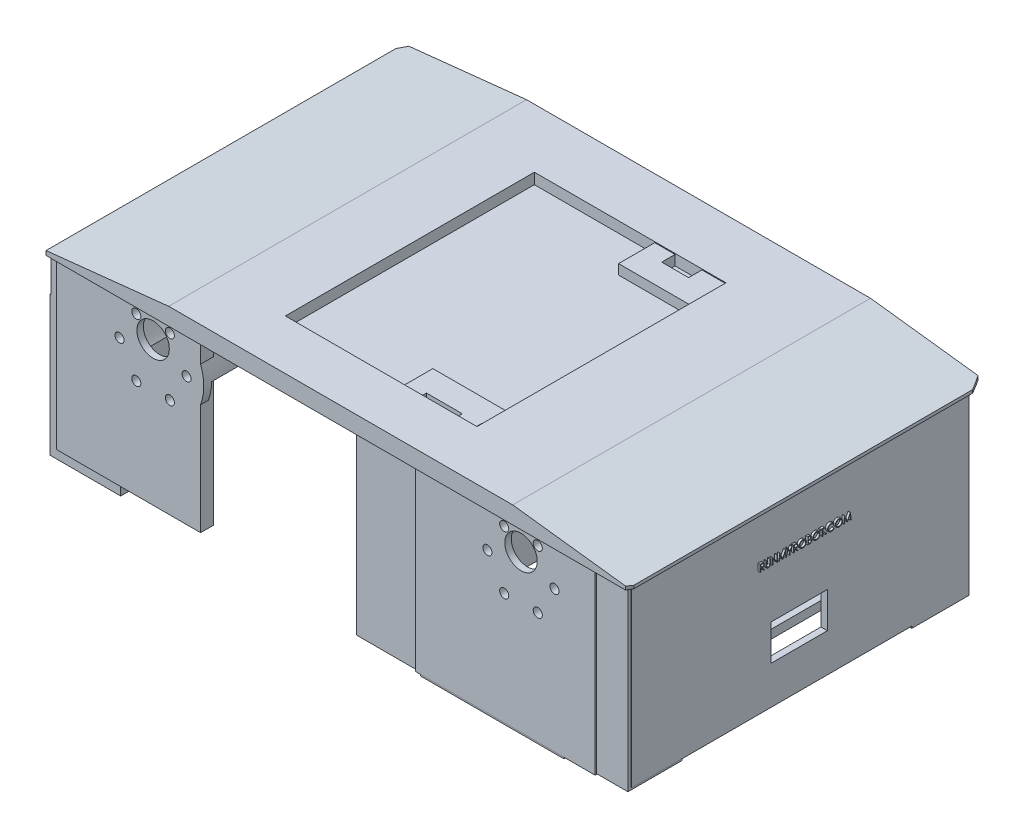
from build123d import *

# Parameters (mm, degrees)
MOTORHOLDERS_DEPTH            = 80
MOTORHOLDERS_DEPTH_BACK       = 80
MOTORHOLDERSSKETCH_R          = 23.41
MOTORHOLDERS_2_DEPTH          = 80
MOTORHOLDERS_2_DEPTH_BACK     = 80
SKETCH4_W                     = 262.774983374
SKETCH4_H                     = 153.112553215
CUT_EXTRUDE1_DEPTH            = 26
POWERBANKHOLDERS_DEPTH        = 30
POWERBANKHOLDERS_DEPTH_BACK   = 59
SKETCH6_W                     = 74.414236541
SKETCH6_H                     = 13.420779118
SKETCH6_W_2                   = 20.810206851
SKETCH6_H_2                   = 2.021058642
POWERBANKHOLDERS_2_DEPTH      = 30
POWERBANKHOLDERS_2_DEPTH_BACK = 59
SKETCH6_W_3                   = 32.64776113
SKETCH6_H_3                   = 26.17260787
SKETCH6_W_4                   = 10.842850571
SKETCH6_H_4                   = 10.347679347
POWERBANKHOLDERS_3_DEPTH      = 30
POWERBANKHOLDERS_3_DEPTH_BACK = 59
SKETCH6_W_5                   = 55.674763771
SKETCH6_H_5                   = 37.111507406
SKETCH6_W_6                   = 12.844328805
SKETCH6_H_6                   = 18.336479725
SKETCH6_W_7                   = 12.407504742
SKETCH6_H_7                   = 16.443461188
POWERBANKHOLDERS_4_DEPTH      = 30
POWERBANKHOLDERS_4_DEPTH_BACK = 59
SKETCH6_W_8                   = 56.474336521
SKETCH6_H_8                   = 35.272094794
SKETCH6_W_9                   = 11.134493861
SKETCH6_H_9                   = 18.035399163
SKETCH6_W_10                  = 16.537391536
SKETCH6_H_10                  = 14.436538778
POWERBANKHOLDERS_5_DEPTH      = 30
POWERBANKHOLDERS_5_DEPTH_BACK = 59
SKETCH6_W_11                  = 28.150495439
SKETCH6_H_11                  = 24.933985152
SKETCH6_W_12                  = 10.177859407
SKETCH6_H_12                  = 9.83070569
POWERBANKHOLDERS_6_DEPTH      = 30
POWERBANKHOLDERS_6_DEPTH_BACK = 59
SKETCH6_W_13                  = 30.670744753
SKETCH6_H_13                  = 26.330219561
SKETCH6_W_14                  = 9.898416255
SKETCH6_H_14                  = 10.635603546
POWERBANKCUT_DEPTH            = 64
BOTTOMPLATE_DEPTH             = 5
BOTTOMPLATE_DEPTH_BACK        = 3
SKETCH21_R                    = 156.395305675
SKETCH21_W                    = 88.537320887
SKETCH21_H                    = 115.069025425
SKETCH23_W                    = 66.548697278
SKETCH23_H                    = 81.163054316
SKETCH23_W_2                  = 82.936115801
SKETCH23_H_2                  = 87.063331284
MOTORMOUNTINGSUPPORT1_DEPTH   = 6
SKETCH24_W                    = 62.643465408
SKETCH24_H                    = 86.363062387
SKETCH24_W_2                  = 53.914675369
SKETCH24_H_2                  = 86.674739968
MOTORMOUNTINGSUPPOR2_DEPTH    = 6
SKETCH17_R                    = 2.1
SKETCH17_R_2                  = 7.5
MOTORHOLES1_DEPTH             = 31.5
SKETCH19_R                    = 2.1
SKETCH19_R_2                  = 7.5
CUT_EXTRUDE4_DEPTH            = 30
BOLTHOLESSKETCH3_R            = 2.1
BOLTHOLESSKETCH3_R_2          = 7.5
MOTORHOLES3_DEPTH             = 31.5
BOLTHOLESSKETCH4_R            = 2.1
BOLTHOLESSKETCH4_R_2          = 7.5
MOTORHOLES4_DEPTH             = 15
SKETCH29_W                    = 154.635205036
SKETCH29_H                    = 84.131588093
SKETCH29_W_2                  = 26
SKETCH29_H_2                  = 16.5
BOSS_EXTRUDE8_DEPTH           = 3
SKETCH27_W                    = 226.46009322
SKETCH27_H                    = 129.985211715
BOSS_EXTRUDE6_DEPTH           = 3
BOSS_EXTRUDE7_DEPTH           = 1.5
BOSS_EXTRUDE7_DEPTH_BACK      = 2.5
SKETCH28_W                    = 66.387115975
SKETCH28_H                    = 157.698901517
MOTORHOLDERCUT_DEPTH          = 77
MOTORHOLDERCUT_DEPTH_BACK     = 77
MOTORHOLDEREXTRUDESKETCH_R    = 20.415
BOSS_EXTRUDE9_DEPTH           = 1
CUT_EXTRUDE5_DEPTH            = 20
CUT_EXTRUDE5_DEPTH_BACK       = 20
SKETCH32_W                    = 420.045569038
SKETCH32_H                    = 425.046527557
SKETCH32_W_2                  = 269.205670794
SKETCH32_H_2                  = 165.352220901
CUT_EXTRUDE7_DEPTH            = 200


with BuildPart() as part:
    # MotorHoldersSketch → MotorHolders (new, two sides: drawn at the far end of the back side and taken through both)
    with BuildSketch(Plane.XY.offset(-MOTORHOLDERS_DEPTH_BACK)):
        Circle(MOTORHOLDERSSKETCH_R)
    extrude(amount=MOTORHOLDERS_DEPTH + MOTORHOLDERS_DEPTH_BACK)


with BuildPart() as body_2:
    # MotorHoldersSketch → MotorHolders 2 (new, two sides: drawn at the far end of the back side and taken through both)
    with BuildSketch(Plane.XY.offset(-MOTORHOLDERS_2_DEPTH_BACK)):
        with Locations((170, 0)):
            Circle(MOTORHOLDERSSKETCH_R)
    extrude(amount=MOTORHOLDERS_2_DEPTH + MOTORHOLDERS_2_DEPTH_BACK)


with BuildPart() as cut_extrude1_tool:
    # Sketch4 → Cut-Extrude1 (new body)
    with BuildSketch(Plane(origin=(0, 0, 0), x_dir=(1, 0, 0), z_dir=(0, 1, 0))):
        with Locations((89.893628689, 0.176832173)):
            Rectangle(SKETCH4_W, SKETCH4_H)
    extrude(amount=-CUT_EXTRUDE1_DEPTH)


with BuildPart() as part_1:
    add(part.part)

    # Cut-Extrude1: cut by cut_extrude1_tool
    add(cut_extrude1_tool.part, mode=Mode.SUBTRACT)


with BuildPart() as body_2_1:
    add(body_2.part)

    # Cut-Extrude1: cut by cut_extrude1_tool
    add(cut_extrude1_tool.part, mode=Mode.SUBTRACT)


with BuildPart() as body_3:
    # Sketch6 → PowerBankHolders (new, two sides: drawn at the far end of the back side and taken through both)
    with BuildSketch(Plane(origin=(170, -34.829272125, 0), x_dir=(-1, 0, 0), z_dir=(0, -1, 0)).offset(-POWERBANKHOLDERS_DEPTH_BACK)):
        with Locations((182.378728269, 72.238602394)):
            Rectangle(SKETCH6_W, SKETCH6_H)
        with Locations((203.359863582, 72.025840015)):
            Rectangle(SKETCH6_W_2, SKETCH6_H_2, mode=Mode.SUBTRACT)
    extrude(amount=POWERBANKHOLDERS_DEPTH + POWERBANKHOLDERS_DEPTH_BACK)


with BuildPart() as body_4:
    # Sketch6 → PowerBankHolders 2 (new, two sides: drawn at the far end of the back side and taken through both)
    with BuildSketch(Plane(origin=(170, -34.829272125, 0), x_dir=(-1, 0, 0), z_dir=(0, -1, 0)).offset(-POWERBANKHOLDERS_2_DEPTH_BACK)):
        with Locations((202.990846936, -65.195848087)):
            Rectangle(SKETCH6_W_3, SKETCH6_H_3)
        with Locations((206.519672379, -65.314281269)):
            Rectangle(SKETCH6_W_4, SKETCH6_H_4, mode=Mode.SUBTRACT)
    extrude(amount=POWERBANKHOLDERS_2_DEPTH + POWERBANKHOLDERS_2_DEPTH_BACK)


with BuildPart() as body_5:
    # Sketch6 → PowerBankHolders 3 (new, two sides: drawn at the far end of the back side and taken through both)
    with BuildSketch(Plane(origin=(170, -34.829272125, 0), x_dir=(-1, 0, 0), z_dir=(0, -1, 0)).offset(-POWERBANKHOLDERS_3_DEPTH_BACK)):
        with Locations((47.827743092, 59.306920349)):
            Rectangle(SKETCH6_W_5, SKETCH6_H_5)
        with Locations((34.93306737, 60.00949088)):
            Rectangle(SKETCH6_W_6, SKETCH6_H_6, mode=Mode.SUBTRACT)
        with Locations((60.073413265, 59.541495334)):
            Rectangle(SKETCH6_W_7, SKETCH6_H_7, mode=Mode.SUBTRACT)
    extrude(amount=POWERBANKHOLDERS_3_DEPTH + POWERBANKHOLDERS_3_DEPTH_BACK)


with BuildPart() as body_6:
    # Sketch6 → PowerBankHolders 4 (new, two sides: drawn at the far end of the back side and taken through both)
    with BuildSketch(Plane(origin=(170, -34.829272125, 0), x_dir=(-1, 0, 0), z_dir=(0, -1, 0)).offset(-POWERBANKHOLDERS_4_DEPTH_BACK)):
        with Locations((48.322417758, -61.807610384)):
            Rectangle(SKETCH6_W_8, SKETCH6_H_8)
        with Locations((37.73953158, -63.792391966)):
            Rectangle(SKETCH6_W_9, SKETCH6_H_9, mode=Mode.SUBTRACT)
        with Locations((59.979410768, -62.645522509)):
            Rectangle(SKETCH6_W_10, SKETCH6_H_10, mode=Mode.SUBTRACT)
    extrude(amount=POWERBANKHOLDERS_4_DEPTH + POWERBANKHOLDERS_4_DEPTH_BACK)


with BuildPart() as body_7:
    # Sketch6 → PowerBankHolders 5 (new, two sides: drawn at the far end of the back side and taken through both)
    with BuildSketch(Plane(origin=(170, -34.829272125, 0), x_dir=(-1, 0, 0), z_dir=(0, -1, 0)).offset(-POWERBANKHOLDERS_5_DEPTH_BACK)):
        with Locations((-34.775388772, -66.976665205)):
            Rectangle(SKETCH6_W_11, SKETCH6_H_11)
        with Locations((-36.725173705, -67.894738702)):
            Rectangle(SKETCH6_W_12, SKETCH6_H_12, mode=Mode.SUBTRACT)
    extrude(amount=POWERBANKHOLDERS_5_DEPTH + POWERBANKHOLDERS_5_DEPTH_BACK)


with BuildPart() as body_8:
    # Sketch6 → PowerBankHolders 6 (new, two sides: drawn at the far end of the back side and taken through both)
    with BuildSketch(Plane(origin=(170, -34.829272125, 0), x_dir=(-1, 0, 0), z_dir=(0, -1, 0)).offset(-POWERBANKHOLDERS_6_DEPTH_BACK)):
        with Locations((-33.722690809, 64.697564271)):
            Rectangle(SKETCH6_W_13, SKETCH6_H_13)
        with Locations((-36.585452129, 63.859928969)):
            Rectangle(SKETCH6_W_14, SKETCH6_H_14, mode=Mode.SUBTRACT)
    extrude(amount=POWERBANKHOLDERS_6_DEPTH + POWERBANKHOLDERS_6_DEPTH_BACK)


with BuildPart() as powerbankcut_tool:
    # Sketch11 → PowerBankCut (new body)
    with BuildSketch(Plane(origin=(0, -20.425, 0), x_dir=(1, 0, 0), z_dir=(0, 1, 0))):
        Polygon((-18.932660375, -64.758061011), (-18.932660375, 72.241938989), (188.932660375, 63.758061011), (188.932660375, -71.241938989), align=None)
    extrude(amount=-POWERBANKCUT_DEPTH)


with BuildPart() as body_3_1:
    add(body_3.part)

    # PowerBankCut: cut by powerbankcut_tool
    add(powerbankcut_tool.part, mode=Mode.SUBTRACT)



with BuildPart() as body_4_1:
    add(body_4.part)

    # PowerBankCut: cut by powerbankcut_tool
    add(powerbankcut_tool.part, mode=Mode.SUBTRACT)


with BuildPart() as body_5_1:
    add(body_5.part)

    # PowerBankCut: cut by powerbankcut_tool
    add(powerbankcut_tool.part, mode=Mode.SUBTRACT)


with BuildPart() as body_6_1:
    add(body_6.part)

    # PowerBankCut: cut by powerbankcut_tool
    add(powerbankcut_tool.part, mode=Mode.SUBTRACT)


with BuildPart() as body_8_1:
    add(body_8.part)

    # PowerBankCut: cut by powerbankcut_tool
    add(powerbankcut_tool.part, mode=Mode.SUBTRACT)


with BuildPart() as body_3_2:
    add(body_3_1.part)

    add(body_4_1.part)  # BottomPlate merges body 4

    add(body_2_1.part)  # BottomPlate merges body 2

    add(part_1.part)  # BottomPlate merges part

    add(body_5_1.part)  # BottomPlate merges body 5

    add(body_6_1.part)  # BottomPlate merges body 6
    # Sketch21 → BottomPlate (add, two sides: drawn at the far end of the back side and taken through both)
    with BuildSketch(Plane(origin=(0, 19.575, 0), x_dir=(1, 0, 0), z_dir=(0, 1, 0)).offset(-BOTTOMPLATE_DEPTH_BACK)):
        with Locations((85, 0)):
            Circle(SKETCH21_R)
        with Locations((82.978570093, -0.057259585)):
            Rectangle(SKETCH21_W, SKETCH21_H, mode=Mode.SUBTRACT)
    extrude(amount=BOTTOMPLATE_DEPTH + BOTTOMPLATE_DEPTH_BACK)


    add(body_7.part)  # MotorMountingSupport1 merges body 7
    # Sketch23 → MotorMountingSupport1 (add)
    with BuildSketch(Plane.XY.offset(80)):
        with Locations((-11.315777772, -18.741332274)):
            Rectangle(SKETCH23_W, SKETCH23_H)
        with Locations((162.789906406, -21.691470758)):
            Rectangle(SKETCH23_W_2, SKETCH23_H_2)
    extrude(amount=-MOTORMOUNTINGSUPPORT1_DEPTH)


    add(body_8_1.part)  # MotorMountingSuppor2 merges body 8
    # Sketch24 → MotorMountingSuppor2 (add)
    with BuildSketch(Plane(origin=(0, 0, -80), x_dir=(-1, 0, 0), z_dir=(0, 0, -1))):
        with Locations((-170.868787608, -23.94412431)):
            Rectangle(SKETCH24_W, SKETCH24_H)
        with Locations((2.593149567, -20.814772641)):
            Rectangle(SKETCH24_W_2, SKETCH24_H_2)
    extrude(amount=-MOTORMOUNTINGSUPPOR2_DEPTH)

    # Sketch17 → MotorHoles1 (cut)
    with BuildSketch(Plane.XY.offset(80)):
        with Locations((185.5, 0)):
            Circle(SKETCH17_R)
        with Locations((177.75, -13.42)):
            Circle(SKETCH17_R)
        with Locations((162.25, -13.42)):
            Circle(SKETCH17_R)
        with Locations((154.5, 0)):
            Circle(SKETCH17_R)
        with Locations((162.25, 13.42)):
            Circle(SKETCH17_R)
        with Locations((177.75, 13.42)):
            Circle(SKETCH17_R)
        with Locations((170, 7)):
            Circle(SKETCH17_R_2)
    extrude(amount=-MOTORHOLES1_DEPTH, mode=Mode.SUBTRACT)

    # Sketch19 → Cut-Extrude4 (cut)
    with BuildSketch(Plane(origin=(0, 0, -80), x_dir=(-1, 0, 0), z_dir=(0, 0, -1))):
        with Locations((-185.5, 0)):
            Circle(SKETCH19_R)
        with Locations((-177.75, -13.42)):
            Circle(SKETCH19_R)
        with Locations((-162.25, -13.42)):
            Circle(SKETCH19_R)
        with Locations((-154.5, 0)):
            Circle(SKETCH19_R)
        with Locations((-162.25, 13.42)):
            Circle(SKETCH19_R)
        with Locations((-177.75, 13.42)):
            Circle(SKETCH19_R)
        with Locations((-170, 7)):
            Circle(SKETCH19_R_2)
    extrude(amount=-CUT_EXTRUDE4_DEPTH, mode=Mode.SUBTRACT)

    # BoltHolesSketch3 → MotorHoles3 (cut)
    with BuildSketch(Plane.XY.offset(80)):
        with Locations((7.75, -13.42)):
            Circle(BOLTHOLESSKETCH3_R)
        with Locations((15.5, 0)):
            Circle(BOLTHOLESSKETCH3_R)
        with Locations((7.75, 13.42)):
            Circle(BOLTHOLESSKETCH3_R)
        with Locations((-7.75, 13.42)):
            Circle(BOLTHOLESSKETCH3_R)
        with Locations((-15.5, 0)):
            Circle(BOLTHOLESSKETCH3_R)
        with Locations((-7.75, -13.42)):
            Circle(BOLTHOLESSKETCH3_R)
        with Locations((0, 7)):
            Circle(BOLTHOLESSKETCH3_R_2)
    extrude(amount=-MOTORHOLES3_DEPTH, mode=Mode.SUBTRACT)

    # BoltHolesSketch4 → MotorHoles4 (cut)
    with BuildSketch(Plane(origin=(0, 0, -80), x_dir=(-1, 0, 0), z_dir=(0, 0, -1))):
        with Locations((-15.5, 0)):
            Circle(BOLTHOLESSKETCH4_R)
        with Locations((-7.75, 13.42)):
            Circle(BOLTHOLESSKETCH4_R)
        with Locations((7.75, 13.42)):
            Circle(BOLTHOLESSKETCH4_R)
        with Locations((15.5, 0)):
            Circle(BOLTHOLESSKETCH4_R)
        with Locations((7.75, -13.42)):
            Circle(BOLTHOLESSKETCH4_R)
        with Locations((-7.75, -13.42)):
            Circle(BOLTHOLESSKETCH4_R)
        with Locations((0, 7)):
            Circle(BOLTHOLESSKETCH4_R_2)
    extrude(amount=-MOTORHOLES4_DEPTH, mode=Mode.SUBTRACT)

    # Sketch29 → Boss-Extrude8 (add)
    with BuildSketch(Plane(origin=(219.058063185, 0, 0), x_dir=(0, 0, -1), z_dir=(1, 0, 0))):
        with Locations((-0.622085312, -21.859578752)):
            Rectangle(SKETCH29_W, SKETCH29_H)
        with Locations((-0.45071267, -38.005879342)):
            Rectangle(SKETCH29_W_2, SKETCH29_H_2, mode=Mode.SUBTRACT)
    extrude(amount=-BOSS_EXTRUDE8_DEPTH)

    # Sketch27 → Boss-Extrude6 (add)
    with BuildSketch(Plane(origin=(0, 16.575, 0), x_dir=(-1, 0, 0), z_dir=(0, -1, 0))):
        with Locations((-81.596376522, -0.440920076)):
            Rectangle(SKETCH27_W, SKETCH27_H)
    extrude(amount=-BOSS_EXTRUDE6_DEPTH)

    # Sketch28 → Boss-Extrude7 (add, two sides: drawn at the far end of the back side and taken through both)
    with BuildSketch(Plane(origin=(0, -64.829272125, 0), x_dir=(-1, 0, 0), z_dir=(0, -1, 0)).offset(-BOSS_EXTRUDE7_DEPTH_BACK)):
        with Locations((-156.196154729, -0.699595313)):
            Rectangle(SKETCH28_W, SKETCH28_H)
    extrude(amount=BOSS_EXTRUDE7_DEPTH + BOSS_EXTRUDE7_DEPTH_BACK)

    # MotorHolderExtrudeSketch → MotorHolderCut (cut, two sides: drawn at the far end of the back side and taken through both)
    with BuildSketch(Plane.XY.offset(-MOTORHOLDERCUT_DEPTH_BACK)):
        with Locations((170, 0)):
            Circle(MOTORHOLDEREXTRUDESKETCH_R)
        Circle(MOTORHOLDEREXTRUDESKETCH_R)
    extrude(amount=MOTORHOLDERCUT_DEPTH + MOTORHOLDERCUT_DEPTH_BACK, mode=Mode.SUBTRACT)

    # Sketch31 → Boss-Extrude9 (add)
    # profile 1 of 14: a face of its own
    with BuildSketch(Plane(origin=(219.058063185, 0, 0), x_dir=(0, 0, -1), z_dir=(1, 0, 0))):
        with BuildLine():
            Line((-19.523067462, -3.211949724), (-18.887685851, -3.211949724))
            add(Edge.make_bspline(
                [(-18.887685851, -3.211949724), (-18.84528497, -3.212090863), (-18.763870582, -3.212361865), (-18.647236258, -3.21387295), (-18.541257392, -3.218203972), (-18.445989395, -3.221931045), (-18.361434015, -3.228727306), (-18.287331972, -3.235223036), (-18.224024561, -3.243726285), (-18.185701539, -3.251623347), (-18.168349914, -3.255198923)],
                knots=[0, 0, 0, 0, 1.410062039, 2.707475311, 3.878576406, 4.937260626, 5.877586885, 6.699081471, 7.410979367, 8, 8, 8, 8], degree=3))
            add(Edge.make_bspline(
                [(-18.168349914, -3.255198923), (-18.145121047, -3.260938203), (-18.09915885, -3.272294329), (-18.032982719, -3.296296966), (-17.969923296, -3.32407334), (-17.910242527, -3.356697572), (-17.854239345, -3.394411837), (-17.801336306, -3.436565062), (-17.75129335, -3.482926599), (-17.7061343, -3.534665348), (-17.663553874, -3.58894561), (-17.627641334, -3.647641161), (-17.596683742, -3.709019832), (-17.572036202, -3.773705847), (-17.552189754, -3.841071883), (-17.538195951, -3.911728148), (-17.529803803, -3.985352747), (-17.528949405, -4.035570279), (-17.52851618, -4.061033258)],
                knots=[0, 0, 0, 0, 1.027469482, 2.033020251, 3.019912614, 3.986113645, 4.951240523, 5.91722682, 6.890402269, 7.87763091, 8.8651537, 9.85103654, 10.82876324, 11.815024772, 12.821070561, 13.842952187, 14.906261191, 16, 16, 16, 16], degree=3))
            add(Edge.make_bspline(
                [(-17.52851618, -4.061033258), (-17.529848771, -4.10333796), (-17.532449001, -4.185885391), (-17.556692488, -4.305683476), (-17.596404045, -4.417433783), (-17.651125886, -4.520995604), (-17.720812125, -4.614350261), (-17.8045639, -4.696347317), (-17.902427933, -4.764963524), (-17.993531669, -4.812545711), (-18.074008122, -4.843019278), (-18.14025977, -4.864460832), (-18.2125291, -4.881027043), (-18.290123682, -4.89586802), (-18.373366426, -4.907072771), (-18.462057819, -4.915279325), (-18.556261114, -4.920408355), (-18.620975841, -4.921172174), (-18.654267382, -4.921565109)],
                knots=[0, 0, 0, 0, 1.260483769, 2.459530307, 3.627416485, 4.787058657, 5.939039949, 7.08810263, 8.267026773, 9.491475466, 10.141966685, 10.831826277, 11.566392101, 12.351337768, 13.187381173, 14.07005841, 15.007169909, 16, 16, 16, 16], degree=3))
            Line((-18.654267382, -4.921565109), (-17.487811051, -6.386949724))
            Line((-17.487811051, -6.386949724), (-17.840164818, -6.386949724))
            Line((-17.840164818, -6.386949724), (-19.006621148, -4.921565109))
            Line((-19.006621148, -4.921565109), (-19.238131564, -4.921565109))
            Line((-19.238131564, -4.921565109), (-19.238131564, -6.386949724))
            Line((-19.238131564, -6.386949724), (-19.523067462, -6.386949724))
            Line((-19.523067462, -6.386949724), (-19.523067462, -3.211949724))
        make_face()
        with BuildLine():
            Line((-19.238131564, -3.53759075), (-19.238131564, -4.595924083))
            Line((-19.238131564, -4.595924083), (-18.656811452, -4.600376207))
            add(Edge.make_bspline(
                [(-18.656811452, -4.600376207), (-18.629669703, -4.600388214), (-18.577061261, -4.600411488), (-18.500951373, -4.596788563), (-18.430085271, -4.592667124), (-18.364734018, -4.586363075), (-18.304868417, -4.578238638), (-18.250518392, -4.568075931), (-18.201595224, -4.556235846), (-18.144537264, -4.537910085), (-18.080822696, -4.508876054), (-18.011579158, -4.466634495), (-17.952612751, -4.413503937), (-17.902794405, -4.352749444), (-17.862762706, -4.285950847), (-17.834539628, -4.213908855), (-17.816630413, -4.138442191), (-17.814518089, -4.086573479), (-17.813452077, -4.06039724)],
                knots=[0, 0, 0, 0, 1.146690395, 2.22261258, 3.21895312, 4.145990853, 4.996080663, 5.770904154, 6.481378293, 7.121626537, 8.300444488, 9.431385265, 10.535395872, 11.636531494, 12.74115979, 13.810798291, 14.895190096, 16, 16, 16, 16], degree=3))
            add(Edge.make_bspline(
                [(-17.813452077, -4.06039724), (-17.814542573, -4.034864277), (-17.816703537, -3.98426726), (-17.834346348, -3.910193685), (-17.864181716, -3.840282951), (-17.904388317, -3.774819454), (-17.953373265, -3.715396394), (-18.010811567, -3.664553619), (-18.075132708, -3.622598748), (-18.135250152, -3.595788703), (-18.188984045, -3.579351407), (-18.235638094, -3.56778428), (-18.288353506, -3.558491083), (-18.347386243, -3.551045199), (-18.412484294, -3.544645357), (-18.483976813, -3.540334815), (-18.561389464, -3.537782238), (-18.61504418, -3.537656065), (-18.642819064, -3.53759075)],
                knots=[0, 0, 0, 0, 1.101028733, 2.181837193, 3.264309656, 4.369019818, 5.486613113, 6.575447106, 7.666700264, 8.788928104, 9.402425223, 10.0903467, 10.862060571, 11.710948788, 12.657782767, 13.684531032, 14.801375019, 16, 16, 16, 16], degree=3))
            Line((-18.642819064, -3.53759075), (-19.238131564, -3.53759075))
        make_face(mode=Mode.SUBTRACT)
    # profile 2 of 14: a face of its own
    with BuildSketch(Plane(origin=(219.058063185, 0, 0), x_dir=(0, 0, -1), z_dir=(1, 0, 0))):
        with BuildLine():
            Line((-16.836529, -3.211949724), (-16.551593103, -3.211949724))
            Line((-16.551593103, -3.211949724), (-16.551593103, -5.11427845))
            add(Edge.make_bspline(
                [(-16.551593103, -5.11427845), (-16.551635506, -5.141203118), (-16.551715974, -5.192297314), (-16.551178479, -5.265021415), (-16.549673195, -5.329675717), (-16.548724179, -5.38650944), (-16.546612955, -5.435261789), (-16.544891155, -5.476196892), (-16.542677222, -5.509120919), (-16.540016465, -5.528335045), (-16.53887275, -5.536594155)],
                knots=[0, 0, 0, 0, 1.528628734, 2.90083645, 4.128790002, 5.200304208, 6.127813768, 6.898992206, 7.526736466, 8, 8, 8, 8], degree=3))
            add(Edge.make_bspline(
                [(-16.53887275, -5.536594155), (-16.534176055, -5.566390862), (-16.525047308, -5.624305338), (-16.501782379, -5.706772136), (-16.469290789, -5.781095673), (-16.430788886, -5.849595202), (-16.380050017, -5.910364121), (-16.319268239, -5.966345406), (-16.245628406, -6.015305543), (-16.163749142, -6.06007378), (-16.075497534, -6.096055676), (-15.985317314, -6.123263942), (-15.89456404, -6.139845516), (-15.83380709, -6.141765519), (-15.803636372, -6.142718955)],
                knots=[0, 0, 0, 0, 1.035780045, 2.013197591, 2.933192213, 3.817615948, 4.702609284, 5.640816605, 6.646850145, 7.73207398, 8.84249596, 9.914020372, 10.964143139, 12, 12, 12, 12], degree=3))
            add(Edge.make_bspline(
                [(-15.803636372, -6.142718955), (-15.77773405, -6.141744819), (-15.726079012, -6.139802174), (-15.649328893, -6.127772162), (-15.574580223, -6.106090935), (-15.501463892, -6.078114868), (-15.432928356, -6.041150982), (-15.368935376, -5.998451006), (-15.311818093, -5.948366854), (-15.259695481, -5.892940113), (-15.214306646, -5.830401866), (-15.174962825, -5.762113841), (-15.142735732, -5.687048362), (-15.126821248, -5.634293993), (-15.118645386, -5.607192112)],
                knots=[0, 0, 0, 0, 0.994687771, 1.983630487, 2.973142513, 3.978332533, 4.983357753, 5.956394766, 6.925816176, 7.893390482, 8.871859704, 9.88551698, 10.913711441, 12, 12, 12, 12], degree=3))
            add(Edge.make_bspline(
                [(-15.118645386, -5.607192112), (-15.115923844, -5.595990191), (-15.109859151, -5.571027797), (-15.104192189, -5.52882634), (-15.098289841, -5.479033846), (-15.094194481, -5.421292558), (-15.090201945, -5.355795962), (-15.087813372, -5.282202857), (-15.08670935, -5.200780471), (-15.086380347, -5.143959617), (-15.086208487, -5.11427845)],
                knots=[0, 0, 0, 0, 0.558680831, 1.244966039, 2.062412453, 2.990489873, 4.051219941, 5.244515665, 6.560634259, 8, 8, 8, 8], degree=3))
            Line((-15.086208487, -5.11427845), (-15.086208487, -3.211949724))
            Line((-15.086208487, -3.211949724), (-14.80127259, -3.211949724))
            Line((-14.80127259, -3.211949724), (-14.80127259, -5.129542873))
            add(Edge.make_bspline(
                [(-14.80127259, -5.129542873), (-14.801503113, -5.164103546), (-14.801952994, -5.231550799), (-14.805854231, -5.330385246), (-14.81207451, -5.424141165), (-14.82086299, -5.512831158), (-14.832507985, -5.59613786), (-14.84545765, -5.674791471), (-14.861949083, -5.7482274), (-14.881210811, -5.817018236), (-14.903230387, -5.882500809), (-14.931752, -5.944647909), (-14.963887082, -6.005348829), (-15.002000375, -6.06368547), (-15.044827843, -6.119916129), (-15.093316154, -6.17369979), (-15.145861642, -6.225895925), (-15.203337814, -6.275165635), (-15.264797219, -6.320349221), (-15.330057038, -6.360080056), (-15.398615965, -6.393665766), (-15.470295786, -6.421311783), (-15.545127092, -6.442098598), (-15.623111768, -6.457588204), (-15.704427322, -6.466389574), (-15.759730975, -6.46769761), (-15.787735931, -6.468359981)],
                knots=[0, 0, 0, 0, 1.316592851, 2.569410997, 3.76748051, 4.895814652, 5.963796859, 6.97159953, 7.931736103, 8.829262218, 9.692595152, 10.560224239, 11.431080259, 12.30701507, 13.211635791, 14.121146779, 15.063487852, 16.031507147, 17.00238618, 17.966455255, 18.938106653, 19.907068911, 20.888905087, 21.893141452, 22.933117798, 24, 24, 24, 24], degree=3))
            add(Edge.make_bspline(
                [(-15.787735931, -6.468359981), (-15.818278617, -6.467648086), (-15.878203258, -6.466251353), (-15.96650279, -6.458247858), (-16.051152097, -6.4431726), (-16.133045214, -6.423977508), (-16.211067208, -6.397503689), (-16.286263404, -6.366571819), (-16.357345922, -6.328583161), (-16.425467931, -6.286316298), (-16.48880896, -6.238759662), (-16.546954461, -6.186925361), (-16.60000043, -6.131643733), (-16.647052747, -6.072316258), (-16.688890978, -6.009404353), (-16.724931957, -5.942730042), (-16.755877543, -5.872319141), (-16.771849215, -5.823375881), (-16.779923431, -5.798633418)],
                knots=[0, 0, 0, 0, 1.13879206, 2.234305948, 3.301075583, 4.341971843, 5.366689343, 6.369221514, 7.369726634, 8.367512178, 9.355451585, 10.318319045, 11.268648973, 12.207971039, 13.137398894, 14.081662264, 15.030215811, 16, 16, 16, 16], degree=3))
            add(Edge.make_bspline(
                [(-16.779923431, -5.798633418), (-16.784619853, -5.781731011), (-16.794806497, -5.745069314), (-16.80571516, -5.684393714), (-16.814885541, -5.614530182), (-16.823508441, -5.535473935), (-16.828596567, -5.447163699), (-16.833057386, -5.349637754), (-16.836560426, -5.242778174), (-16.836539768, -5.168343007), (-16.836529, -5.129542873)],
                knots=[0, 0, 0, 0, 0.625038921, 1.35572334, 2.194682327, 3.136881307, 4.189498639, 5.346923369, 6.617055217, 8, 8, 8, 8], degree=3))
            Line((-16.836529, -5.129542873), (-16.836529, -3.211949724))
        make_face()
    # profile 3 of 14: a face of its own
    with BuildSketch(Plane(origin=(219.058063185, 0, 0), x_dir=(0, 0, -1), z_dir=(1, 0, 0))):
        Polygon((-13.987170026, -6.386949724), (-13.987170026, -3.211949724), (-13.927384369, -3.211949724), (-11.829798231, -5.710862985), (-11.829798231, -3.211949724), (-11.544862334, -3.211949724), (-11.544862334, -6.386949724), (-11.609736132, -6.386949724), (-13.702234128, -3.893760622), (-13.702234128, -6.386949724), align=None)
    # profile 4 of 14: a face of its own
    with BuildSketch(Plane(origin=(219.058063185, 0, 0), x_dir=(0, 0, -1), z_dir=(1, 0, 0))):
        Polygon((-10.893580282, -6.386949724), (-10.474444665, -3.211949724), (-10.433739537, -3.211949724), (-9.122907205, -5.817077929), (-7.815254962, -3.211949724), (-7.773913816, -3.211949724), (-7.352234128, -6.386949724), (-7.638442061, -6.386949724), (-7.942458487, -4.102374404), (-9.088562253, -6.386949724), (-9.152800034, -6.386949724), (-10.303355923, -4.097286263), (-10.606736332, -6.386949724), align=None)
    # profile 5 of 14: a face of its own
    with BuildSketch(Plane(origin=(219.058063185, 0, 0), x_dir=(0, 0, -1), z_dir=(1, 0, 0))):
        Polygon((-6.945182846, -3.211949724), (-6.618905803, -3.211949724), (-5.784450675, -4.576207537), (-4.951267582, -3.211949724), (-4.624990539, -3.211949724), (-5.642618744, -4.877679892), (-5.642618744, -6.386949724), (-5.927554641, -6.386949724), (-5.927554641, -4.877679892), align=None)
    # profile 6 of 14: a face of its own
    with BuildSketch(Plane(origin=(219.058063185, 0, 0), x_dir=(0, 0, -1), z_dir=(1, 0, 0))):
        with BuildLine():
            Line((-4.055118744, -3.211949724), (-3.419737133, -3.211949724))
            add(Edge.make_bspline(
                [(-3.419737133, -3.211949724), (-3.377336252, -3.212090863), (-3.295921864, -3.212361865), (-3.17928754, -3.21387295), (-3.073308674, -3.218203972), (-2.978040677, -3.221931045), (-2.893485297, -3.228727306), (-2.819383255, -3.235223036), (-2.756075843, -3.243726285), (-2.717752821, -3.251623347), (-2.700401196, -3.255198923)],
                knots=[0, 0, 0, 0, 1.410062039, 2.707475311, 3.878576406, 4.937260626, 5.877586885, 6.699081471, 7.410979367, 8, 8, 8, 8], degree=3))
            add(Edge.make_bspline(
                [(-2.700401196, -3.255198923), (-2.67717233, -3.260938203), (-2.631210132, -3.272294329), (-2.565034001, -3.296296966), (-2.501974578, -3.32407334), (-2.442293809, -3.356697572), (-2.386290627, -3.394411837), (-2.333387588, -3.436565062), (-2.283344632, -3.482926599), (-2.238185582, -3.534665348), (-2.195605156, -3.58894561), (-2.159692616, -3.647641161), (-2.128735024, -3.709019832), (-2.104087484, -3.773705847), (-2.084241036, -3.841071883), (-2.070247233, -3.911728148), (-2.061855085, -3.985352747), (-2.061000687, -4.035570279), (-2.060567462, -4.061033258)],
                knots=[0, 0, 0, 0, 1.027469482, 2.033020251, 3.019912614, 3.986113645, 4.951240523, 5.91722682, 6.890402269, 7.87763091, 8.8651537, 9.85103654, 10.82876324, 11.815024772, 12.821070561, 13.842952187, 14.906261191, 16, 16, 16, 16], degree=3))
            add(Edge.make_bspline(
                [(-2.060567462, -4.061033258), (-2.061900053, -4.10333796), (-2.064500283, -4.185885391), (-2.08874377, -4.305683476), (-2.128455327, -4.417433783), (-2.183177168, -4.520995604), (-2.252863407, -4.614350261), (-2.336615182, -4.696347317), (-2.434479215, -4.764963524), (-2.525582952, -4.812545711), (-2.606059404, -4.843019278), (-2.672311052, -4.864460832), (-2.744580382, -4.881027043), (-2.822174964, -4.89586802), (-2.905417708, -4.907072771), (-2.994109101, -4.915279325), (-3.088312396, -4.920408355), (-3.153027123, -4.921172174), (-3.186318664, -4.921565109)],
                knots=[0, 0, 0, 0, 1.260483769, 2.459530307, 3.627416485, 4.787058657, 5.939039949, 7.08810263, 8.267026773, 9.491475466, 10.141966685, 10.831826277, 11.566392101, 12.351337768, 13.187381173, 14.07005841, 15.007169909, 16, 16, 16, 16], degree=3))
            Line((-3.186318664, -4.921565109), (-2.019862334, -6.386949724))
            Line((-2.019862334, -6.386949724), (-2.3722161, -6.386949724))
            Line((-2.3722161, -6.386949724), (-3.53867243, -4.921565109))
            Line((-3.53867243, -4.921565109), (-3.770182846, -4.921565109))
            Line((-3.770182846, -4.921565109), (-3.770182846, -6.386949724))
            Line((-3.770182846, -6.386949724), (-4.055118744, -6.386949724))
            Line((-4.055118744, -6.386949724), (-4.055118744, -3.211949724))
        make_face()
        with BuildLine():
            Line((-3.770182846, -3.53759075), (-3.770182846, -4.595924083))
            Line((-3.770182846, -4.595924083), (-3.188862734, -4.600376207))
            add(Edge.make_bspline(
                [(-3.188862734, -4.600376207), (-3.161720985, -4.600388214), (-3.109112543, -4.600411488), (-3.033002655, -4.596788563), (-2.962136553, -4.592667124), (-2.8967853, -4.586363075), (-2.836919699, -4.578238638), (-2.782569674, -4.568075931), (-2.733646506, -4.556235846), (-2.676588546, -4.537910085), (-2.612873978, -4.508876054), (-2.54363044, -4.466634495), (-2.484664033, -4.413503937), (-2.434845687, -4.352749444), (-2.394813988, -4.285950847), (-2.36659091, -4.213908855), (-2.348681695, -4.138442191), (-2.346569371, -4.086573479), (-2.345503359, -4.06039724)],
                knots=[0, 0, 0, 0, 1.146690395, 2.22261258, 3.21895312, 4.145990853, 4.996080663, 5.770904154, 6.481378293, 7.121626537, 8.300444488, 9.431385265, 10.535395872, 11.636531494, 12.74115979, 13.810798291, 14.895190096, 16, 16, 16, 16], degree=3))
            add(Edge.make_bspline(
                [(-2.345503359, -4.06039724), (-2.346593855, -4.034864277), (-2.348754819, -3.98426726), (-2.36639763, -3.910193685), (-2.396232998, -3.840282951), (-2.436439599, -3.774819454), (-2.485424547, -3.715396394), (-2.542862849, -3.664553619), (-2.60718399, -3.622598748), (-2.667301434, -3.595788703), (-2.721035327, -3.579351407), (-2.767689376, -3.56778428), (-2.820404788, -3.558491083), (-2.879437525, -3.551045199), (-2.944535576, -3.544645357), (-3.016028095, -3.540334815), (-3.093440746, -3.537782238), (-3.147095462, -3.537656065), (-3.174870346, -3.53759075)],
                knots=[0, 0, 0, 0, 1.101028733, 2.181837193, 3.264309656, 4.369019818, 5.486613113, 6.575447106, 7.666700264, 8.788928104, 9.402425223, 10.0903467, 10.862060571, 11.710948788, 12.657782767, 13.684531032, 14.801375019, 16, 16, 16, 16], degree=3))
            Line((-3.174870346, -3.53759075), (-3.770182846, -3.53759075))
        make_face(mode=Mode.SUBTRACT)
    # profile 7 of 14: a face of its own
    with BuildSketch(Plane(origin=(219.058063185, 0, 0), x_dir=(0, 0, -1), z_dir=(1, 0, 0))):
        with BuildLine():
            add(Edge.make_bspline(
                [(0.117156897, -3.130539468), (0.175947108, -3.132028524), (0.291415931, -3.134953153), (0.461119588, -3.157340626), (0.623130853, -3.196071444), (0.778769479, -3.247654292), (0.926173822, -3.316465056), (1.066453389, -3.399636584), (1.19927441, -3.498040228), (1.322846664, -3.610915313), (1.435928326, -3.733727446), (1.535556094, -3.86478955), (1.619051603, -4.003309178), (1.68761871, -4.148870074), (1.74141102, -4.301143045), (1.778530439, -4.460939891), (1.802241475, -4.627225245), (1.805013501, -4.740642472), (1.806419718, -4.798177689)],
                knots=[0, 0, 0, 0, 1.065120563, 2.091984664, 3.0946048, 4.079830382, 5.057816894, 6.036188127, 7.030412546, 8.04752943, 9.064399622, 10.05169764, 11.02544977, 11.989514704, 12.962713494, 13.945757189, 14.957906945, 16, 16, 16, 16], degree=3))
            add(Edge.make_bspline(
                [(1.806419718, -4.798177689), (1.805013708, -4.855289087), (1.802242299, -4.967862268), (1.778503479, -5.133092392), (1.741273429, -5.291924667), (1.688118245, -5.444093938), (1.619877989, -5.589760728), (1.535826512, -5.72854175), (1.436819843, -5.860482502), (1.324146485, -5.984137563), (1.201318397, -6.097528126), (1.069573798, -6.196333106), (0.931875572, -6.281354276), (0.786451765, -6.349193752), (0.635231017, -6.403415422), (0.47685991, -6.44038388), (0.312080536, -6.464229983), (0.19971184, -6.466968208), (0.142597602, -6.468359981)],
                knots=[0, 0, 0, 0, 1.043624062, 2.057103931, 3.04512605, 4.022047818, 4.998200453, 5.980619268, 6.982898556, 8.009068085, 9.034988726, 10.034168286, 11.015286542, 11.987931943, 12.962482838, 13.94673481, 14.956375938, 16, 16, 16, 16], degree=3))
            add(Edge.make_bspline(
                [(0.142597602, -6.468359981), (0.085062684, -6.466954465), (-0.028353954, -6.464183821), (-0.194848265, -6.440433546), (-0.354757361, -6.403293935), (-0.507623951, -6.350217518), (-0.65353328, -6.281621887), (-0.792770712, -6.197979343), (-0.924777367, -6.098731437), (-1.048458809, -5.986094615), (-1.161624153, -5.863474708), (-1.260284444, -5.732089348), (-1.343945796, -5.594516183), (-1.412311105, -5.450373429), (-1.466435293, -5.300357906), (-1.503360378, -5.14346893), (-1.527250849, -4.98060095), (-1.530003889, -4.869709178), (-1.531400795, -4.813442112)],
                knots=[0, 0, 0, 0, 1.053102029, 2.075944431, 3.073151272, 4.055350789, 5.033113405, 6.020478099, 7.024410459, 8.052272461, 9.079885166, 10.07527673, 11.055994387, 12.023226415, 12.992069828, 13.970394897, 14.97016774, 16, 16, 16, 16], degree=3))
            add(Edge.make_bspline(
                [(-1.531400795, -4.813442112), (-1.530915804, -4.775675334), (-1.529951941, -4.700618222), (-1.518348049, -4.589160663), (-1.501509934, -4.479495566), (-1.477378199, -4.371934778), (-1.445817187, -4.266741599), (-1.408577133, -4.16319055), (-1.363093131, -4.062331029), (-1.311675686, -3.963685238), (-1.254288189, -3.868790923), (-1.190900902, -3.779093015), (-1.123740246, -3.693838826), (-1.050113453, -3.615237615), (-0.972447106, -3.541002798), (-0.889481292, -3.47227519), (-0.801722256, -3.408435056), (-0.708792383, -3.350903747), (-0.612981519, -3.298870818), (-0.514214728, -3.254219567), (-0.41383341, -3.215896354), (-0.311367407, -3.184835034), (-0.207088821, -3.160313116), (-0.10077006, -3.143615016), (0.007504177, -3.131981528), (0.080448731, -3.131022223), (0.117156897, -3.130539468)],
                knots=[0, 0, 0, 0, 1.037015668, 2.060948919, 3.074880161, 4.083647147, 5.086022904, 6.090072063, 7.104153813, 8.122640571, 9.144368836, 10.147691507, 11.138137339, 12.123020368, 13.103399296, 14.087645067, 15.080126199, 16.082011238, 17.087798457, 18.072939717, 19.057185487, 20.037253025, 21.01195951, 21.997135196, 22.992090687, 24, 24, 24, 24], degree=3))
        make_face()
        with BuildLine():
            add(Edge.make_bspline(
                [(0.131149285, -3.456180493), (0.101018867, -3.456547787), (0.041046081, -3.457278862), (-0.048112034, -3.466908833), (-0.136097574, -3.480633803), (-0.22292871, -3.500211326), (-0.308242129, -3.526885002), (-0.392833057, -3.55758354), (-0.475930113, -3.594976958), (-0.557258969, -3.637225054), (-0.636103359, -3.68398729), (-0.710500595, -3.735668821), (-0.780643279, -3.791057652), (-0.846359671, -3.850283048), (-0.907456806, -3.913646615), (-0.965137214, -3.980187754), (-1.017088906, -4.051808398), (-1.064700822, -4.12656641), (-1.107307363, -4.204364415), (-1.145194506, -4.284383362), (-1.176186142, -4.367275978), (-1.201461298, -4.452142964), (-1.222416126, -4.538849909), (-1.235691186, -4.628054572), (-1.245426969, -4.719308709), (-1.246116258, -4.780977963), (-1.246464898, -4.812170077)],
                knots=[0, 0, 0, 0, 1.008559885, 2.007477868, 2.99961109, 3.989939068, 4.984837346, 5.991145699, 7.001802488, 8.033829008, 9.059044045, 10.069351652, 11.065060232, 12.050310815, 13.029377138, 14.011219647, 14.996725999, 15.989392538, 16.977580475, 17.965360261, 18.951710183, 19.937753436, 20.929683414, 21.935841486, 22.955955122, 24, 24, 24, 24], degree=3))
            add(Edge.make_bspline(
                [(-1.246464898, -4.812170077), (-1.245308416, -4.858037234), (-1.243033258, -4.948272122), (-1.223114605, -5.080504653), (-1.192433243, -5.207584741), (-1.147205489, -5.328817045), (-1.090644574, -5.445243644), (-1.020770181, -5.55583171), (-0.937985153, -5.660611132), (-0.843947525, -5.758850412), (-0.741147642, -5.848517677), (-0.631988665, -5.927224484), (-0.517640035, -5.993818067), (-0.397803559, -6.048069812), (-0.273119005, -6.091059074), (-0.142782941, -6.120521832), (-0.007663596, -6.139912424), (0.084439213, -6.141774567), (0.131149285, -6.142718955)],
                knots=[0, 0, 0, 0, 1.032063989, 2.030389145, 3.003944642, 3.970395727, 4.937377036, 5.913328081, 6.909231446, 7.93887556, 8.970685674, 9.976071282, 10.964166581, 11.944589148, 12.933237628, 13.927779006, 14.949070134, 16, 16, 16, 16], degree=3))
            add(Edge.make_bspline(
                [(0.131149285, -6.142718955), (0.162545047, -6.142287605), (0.224812273, -6.141432107), (0.317427497, -6.13281545), (0.408374203, -6.118997969), (0.497524829, -6.099103731), (0.584778193, -6.074205194), (0.670498479, -6.044625326), (0.753772642, -6.007721663), (0.835651209, -5.96694745), (0.914024943, -5.920465307), (0.988842033, -5.870537843), (1.058216672, -5.815230594), (1.123883901, -5.75688515), (1.185231876, -5.694325088), (1.24184574, -5.627631744), (1.29353486, -5.556384147), (1.341128697, -5.481739529), (1.383585942, -5.403728643), (1.420578411, -5.323419578), (1.45196203, -5.241010086), (1.477297174, -5.156381303), (1.497150414, -5.069693962), (1.510830055, -4.980831991), (1.520398996, -4.889973159), (1.521120245, -4.828519804), (1.52148382, -4.797541671)],
                knots=[0, 0, 0, 0, 1.047197238, 2.076906641, 3.100256066, 4.114471768, 5.12198147, 6.126382909, 7.136867548, 8.15857795, 9.17633901, 10.174870724, 11.156907918, 12.133735059, 13.104061851, 14.077631395, 15.04955518, 16.038496417, 17.029181396, 18.010275684, 18.986308667, 19.968651475, 20.955262928, 21.950658345, 22.966943676, 24, 24, 24, 24], degree=3))
            add(Edge.make_bspline(
                [(1.52148382, -4.797541671), (1.521119954, -4.766775464), (1.520398157, -4.705745024), (1.510834626, -4.615519853), (1.497135961, -4.527297297), (1.477394076, -4.441423704), (1.45194858, -4.357877185), (1.42057293, -4.276736207), (1.383574837, -4.197698487), (1.34111309, -4.120959375), (1.293383022, -4.047322291), (1.24122753, -3.976925817), (1.183746107, -3.911091973), (1.12258107, -3.8481955), (1.056204624, -3.789577843), (0.984917443, -3.735219557), (0.909584964, -3.683808801), (0.8298224, -3.637430613), (0.747504671, -3.594600559), (0.663037009, -3.55790572), (0.577376326, -3.526725298), (0.490740452, -3.500130622), (0.402400179, -3.48071048), (0.31295242, -3.466896464), (0.222520928, -3.457282214), (0.161703151, -3.456548899), (0.131149285, -3.456180493)],
                knots=[0, 0, 0, 0, 1.02996197, 2.043119294, 3.035359645, 4.018872909, 4.991431989, 5.957985074, 6.929999688, 7.912076566, 8.892894881, 9.867085534, 10.843653904, 11.817741046, 12.803660682, 13.806313499, 14.818574707, 15.856120519, 16.894564902, 17.924820532, 18.937903209, 19.946497019, 20.957711757, 21.963978472, 22.977135795, 24, 24, 24, 24], degree=3))
        make_face(mode=Mode.SUBTRACT)
    # profile 8 of 14: a face of its own
    with BuildSketch(Plane(origin=(219.058063185, 0, 0), x_dir=(0, 0, -1), z_dir=(1, 0, 0))):
        with BuildLine():
            Line((2.457701769, -3.211949724), (3.077182939, -3.211949724))
            add(Edge.make_bspline(
                [(3.077182939, -3.211949724), (3.107507344, -3.212109155), (3.166283588, -3.212418171), (3.251754082, -3.217210726), (3.33180836, -3.223745484), (3.40646964, -3.234114211), (3.47570342, -3.246625323), (3.539718348, -3.261776256), (3.598310861, -3.279943255), (3.668263129, -3.308832382), (3.748019729, -3.351761256), (3.834378271, -3.415196455), (3.908223545, -3.492786617), (3.971892561, -3.580310169), (4.022512148, -3.676590476), (4.059132868, -3.779332741), (4.082317512, -3.887211749), (4.084701877, -3.961273775), (4.085906897, -3.99870353)],
                knots=[0, 0, 0, 0, 1.001505555, 1.941167018, 2.826882275, 3.653841531, 4.429895133, 5.150066043, 5.825578002, 6.45369114, 7.647487171, 8.808567382, 9.977351308, 11.170798116, 12.373658725, 13.556498008, 14.765093433, 16, 16, 16, 16], degree=3))
            add(Edge.make_bspline(
                [(4.085906897, -3.99870353), (4.084915192, -4.03376692), (4.082966397, -4.102669788), (4.06433118, -4.203448015), (4.035156859, -4.299379478), (3.994602812, -4.390114071), (3.941896001, -4.473601705), (3.879431669, -4.550515868), (3.804069141, -4.617600041), (3.747605631, -4.65510396), (3.718924726, -4.674154251)],
                knots=[0, 0, 0, 0, 1.044552857, 2.05264487, 3.044412934, 4.028983338, 5.005914585, 5.980388656, 6.974128949, 8, 8, 8, 8], degree=3))
            add(Edge.make_bspline(
                [(3.718924726, -4.674154251), (3.754993114, -4.688001786), (3.824000874, -4.71449555), (3.918966043, -4.761336293), (4.000785652, -4.81228335), (4.070088778, -4.8679201), (4.129359365, -4.927890235), (4.181114533, -4.993073089), (4.225275494, -5.064318962), (4.263115074, -5.140885026), (4.292641446, -5.221989466), (4.314753874, -5.306871527), (4.327424345, -5.395226838), (4.32922742, -5.455357146), (4.330137666, -5.485712745)],
                knots=[0, 0, 0, 0, 1.27268992, 2.434971085, 3.483601985, 4.442670788, 5.356604649, 6.2567628, 7.179492994, 8.113709626, 9.066344395, 10.018646069, 10.999752585, 12, 12, 12, 12], degree=3))
            add(Edge.make_bspline(
                [(4.330137666, -5.485712745), (4.329251528, -5.516706979), (4.327508024, -5.577689003), (4.314644764, -5.667274018), (4.292865074, -5.752885576), (4.26286482, -5.835077421), (4.223710435, -5.913690543), (4.176060067, -5.988814004), (4.119244292, -6.059693003), (4.055687261, -6.127115147), (3.983785171, -6.187737497), (3.906210165, -6.241726745), (3.821985289, -6.286127816), (3.732493838, -6.323425921), (3.636731922, -6.351916737), (3.535129557, -6.371849001), (3.427774369, -6.385279284), (3.354105523, -6.386383463), (3.316325567, -6.386949724)],
                knots=[0, 0, 0, 0, 0.978564426, 1.925352924, 2.850884081, 3.763762016, 4.682927383, 5.618979971, 6.567305752, 7.547517671, 8.540179244, 9.531824382, 10.526200242, 11.540722885, 12.589160233, 13.674978461, 14.80764778, 16, 16, 16, 16], degree=3))
            Line((3.316325567, -6.386949724), (2.457701769, -6.386949724))
            Line((2.457701769, -6.386949724), (2.457701769, -3.211949724))
        make_face()
        with BuildLine():
            Line((2.742637666, -3.53759075), (2.742637666, -4.555218955))
            Line((2.742637666, -4.555218955), (2.934078973, -4.555218955))
            add(Edge.make_bspline(
                [(2.934078973, -4.555218955), (2.962063237, -4.554856168), (3.016134539, -4.554155189), (3.094439016, -4.552147212), (3.167123854, -4.546524702), (3.234063588, -4.540903807), (3.295152805, -4.531764717), (3.350256165, -4.520886148), (3.400238464, -4.509380941), (3.457877909, -4.489814335), (3.523258369, -4.46089673), (3.592956971, -4.416018707), (3.654401811, -4.362565901), (3.706287832, -4.300888386), (3.748752523, -4.23297406), (3.778247107, -4.159906533), (3.798247144, -4.083506841), (3.800053747, -4.031057426), (3.800971, -4.004427689)],
                knots=[0, 0, 0, 0, 1.156816544, 2.235205308, 3.236616184, 4.169592532, 5.011045266, 5.787822928, 6.49130361, 7.128639758, 8.301311294, 9.436451833, 10.541879658, 11.654887649, 12.756523258, 13.837046038, 14.901820046, 16, 16, 16, 16], degree=3))
            add(Edge.make_bspline(
                [(3.800971, -4.004427689), (3.800493679, -3.986805739), (3.799557363, -3.95223836), (3.79188901, -3.90184716), (3.778855567, -3.854454613), (3.762114887, -3.809411242), (3.738720862, -3.768125492), (3.711176863, -3.729169879), (3.677897701, -3.693871028), (3.640017853, -3.660878698), (3.596467174, -3.631628305), (3.547271645, -3.606009898), (3.491765681, -3.585380765), (3.430884734, -3.56731397), (3.363691676, -3.554624589), (3.290961902, -3.544053301), (3.212099693, -3.538671457), (3.157539493, -3.53795902), (3.129336384, -3.53759075)],
                knots=[0, 0, 0, 0, 0.91205012, 1.789085906, 2.630437955, 3.453916878, 4.269457761, 5.079663411, 5.91843418, 6.774407191, 7.675494373, 8.627863946, 9.638891023, 10.736472738, 11.911756761, 13.175263542, 14.539845004, 16, 16, 16, 16], degree=3))
            Line((3.129336384, -3.53759075), (2.742637666, -3.53759075))
        make_face(mode=Mode.SUBTRACT)
        with BuildLine():
            Line((2.742637666, -4.880859981), (2.742637666, -6.061308699))
            Line((2.742637666, -6.061308699), (3.148416913, -6.061308699))
            add(Edge.make_bspline(
                [(3.148416913, -6.061308699), (3.177462653, -6.060960585), (3.233444488, -6.060289642), (3.314272032, -6.058099296), (3.389186705, -6.053117017), (3.457846657, -6.045273996), (3.520993282, -6.036766403), (3.577869055, -6.02532617), (3.628935023, -6.012218898), (3.688148145, -5.991958613), (3.754826328, -5.960483958), (3.82668189, -5.913027481), (3.890568531, -5.856491337), (3.944820445, -5.791058294), (3.989282227, -5.719909876), (4.021626819, -5.644485166), (4.041575667, -5.566030437), (4.043990635, -5.512539205), (4.045201769, -5.485712745)],
                knots=[0, 0, 0, 0, 1.160039823, 2.235823828, 3.228722157, 4.157150951, 4.99529583, 5.772374946, 6.472645482, 7.099169577, 8.269452708, 9.405989375, 10.527446681, 11.663510218, 12.788923519, 13.866172445, 14.929861265, 16, 16, 16, 16], degree=3))
            add(Edge.make_bspline(
                [(4.045201769, -5.485712745), (4.044951303, -5.468936643), (4.044454411, -5.43565504), (4.036960853, -5.38674569), (4.026062557, -5.339369362), (4.011973328, -5.293397411), (3.99145424, -5.249660991), (3.967499731, -5.207295098), (3.939413316, -5.166243727), (3.895648966, -5.11434404), (3.831992951, -5.054547893), (3.741544662, -4.996003159), (3.638699792, -4.948788362), (3.564107709, -4.92874098), (3.525575367, -4.918385021)],
                knots=[0, 0, 0, 0, 0.723448775, 1.435228256, 2.130040452, 2.821711965, 3.505591119, 4.210454504, 4.921174351, 5.648778258, 7.137944449, 8.670945889, 10.280296675, 12, 12, 12, 12], degree=3))
            add(Edge.make_bspline(
                [(3.525575367, -4.918385021), (3.510127544, -4.915250766), (3.476633478, -4.908455055), (3.422016602, -4.901281639), (3.359663349, -4.894890763), (3.289429739, -4.890163498), (3.211226912, -4.885277134), (3.12488785, -4.883376832), (3.030765143, -4.881109646), (2.965457777, -4.880945331), (2.931534902, -4.880859981)],
                knots=[0, 0, 0, 0, 0.634451884, 1.375622551, 2.216452059, 3.157844607, 4.20941857, 5.370758133, 6.634282058, 8, 8, 8, 8], degree=3))
            Line((2.931534902, -4.880859981), (2.742637666, -4.880859981))
        make_face(mode=Mode.SUBTRACT)
    # profile 9 of 14: a face of its own
    with BuildSketch(Plane(origin=(219.058063185, 0, 0), x_dir=(0, 0, -1), z_dir=(1, 0, 0))):
        with BuildLine():
            add(Edge.make_bspline(
                [(6.467156897, -3.130539468), (6.525947108, -3.132028524), (6.641415931, -3.134953153), (6.811119588, -3.157340626), (6.973130853, -3.196071444), (7.128769479, -3.247654292), (7.276173822, -3.316465056), (7.416453389, -3.399636584), (7.54927441, -3.498040228), (7.672846664, -3.610915313), (7.785928326, -3.733727446), (7.885556094, -3.86478955), (7.969051603, -4.003309178), (8.03761871, -4.148870074), (8.09141102, -4.301143045), (8.128530439, -4.460939891), (8.152241475, -4.627225245), (8.155013501, -4.740642472), (8.156419718, -4.798177689)],
                knots=[0, 0, 0, 0, 1.065120563, 2.091984664, 3.0946048, 4.079830382, 5.057816894, 6.036188127, 7.030412546, 8.04752943, 9.064399622, 10.05169764, 11.02544977, 11.989514704, 12.962713494, 13.945757189, 14.957906945, 16, 16, 16, 16], degree=3))
            add(Edge.make_bspline(
                [(8.156419718, -4.798177689), (8.155013708, -4.855289087), (8.152242299, -4.967862268), (8.128503479, -5.133092392), (8.091273429, -5.291924667), (8.038118245, -5.444093938), (7.969877989, -5.589760728), (7.885826512, -5.72854175), (7.786819843, -5.860482502), (7.674146485, -5.984137563), (7.551318397, -6.097528126), (7.419573798, -6.196333106), (7.281875572, -6.281354276), (7.136451765, -6.349193752), (6.985231017, -6.403415422), (6.82685991, -6.44038388), (6.662080536, -6.464229983), (6.54971184, -6.466968208), (6.492597602, -6.468359981)],
                knots=[0, 0, 0, 0, 1.043624062, 2.057103931, 3.04512605, 4.022047818, 4.998200453, 5.980619268, 6.982898556, 8.009068085, 9.034988726, 10.034168286, 11.015286542, 11.987931943, 12.962482838, 13.94673481, 14.956375938, 16, 16, 16, 16], degree=3))
            add(Edge.make_bspline(
                [(6.492597602, -6.468359981), (6.435062684, -6.466954465), (6.321646046, -6.464183821), (6.155151735, -6.440433546), (5.995242639, -6.403293935), (5.842376049, -6.350217518), (5.69646672, -6.281621887), (5.557229288, -6.197979343), (5.425222633, -6.098731437), (5.301541191, -5.986094615), (5.188375847, -5.863474708), (5.089715556, -5.732089348), (5.006054204, -5.594516183), (4.937688895, -5.450373429), (4.883564707, -5.300357906), (4.846639622, -5.14346893), (4.822749151, -4.98060095), (4.819996111, -4.869709178), (4.818599205, -4.813442112)],
                knots=[0, 0, 0, 0, 1.053102029, 2.075944431, 3.073151272, 4.055350789, 5.033113405, 6.020478099, 7.024410459, 8.052272461, 9.079885166, 10.07527673, 11.055994387, 12.023226415, 12.992069828, 13.970394897, 14.97016774, 16, 16, 16, 16], degree=3))
            add(Edge.make_bspline(
                [(4.818599205, -4.813442112), (4.819084196, -4.775675334), (4.820048059, -4.700618222), (4.831651951, -4.589160663), (4.848490066, -4.479495566), (4.872621801, -4.371934778), (4.904182813, -4.266741599), (4.941422867, -4.16319055), (4.986906869, -4.062331029), (5.038324314, -3.963685238), (5.095711811, -3.868790923), (5.159099098, -3.779093015), (5.226259754, -3.693838826), (5.299886547, -3.615237615), (5.377552894, -3.541002798), (5.460518708, -3.47227519), (5.548277744, -3.408435056), (5.641207617, -3.350903747), (5.737018481, -3.298870818), (5.835785272, -3.254219567), (5.93616659, -3.215896354), (6.038632593, -3.184835034), (6.142911179, -3.160313116), (6.24922994, -3.143615016), (6.357504177, -3.131981528), (6.430448731, -3.131022223), (6.467156897, -3.130539468)],
                knots=[0, 0, 0, 0, 1.037015668, 2.060948919, 3.074880161, 4.083647147, 5.086022904, 6.090072063, 7.104153813, 8.122640571, 9.144368836, 10.147691507, 11.138137339, 12.123020368, 13.103399296, 14.087645067, 15.080126199, 16.082011238, 17.087798457, 18.072939717, 19.057185487, 20.037253025, 21.01195951, 21.997135196, 22.992090687, 24, 24, 24, 24], degree=3))
        make_face()
        with BuildLine():
            add(Edge.make_bspline(
                [(6.481149285, -3.456180493), (6.451018867, -3.456547787), (6.391046081, -3.457278862), (6.301887966, -3.466908833), (6.213902426, -3.480633803), (6.12707129, -3.500211326), (6.041757871, -3.526885002), (5.957166943, -3.55758354), (5.874069887, -3.594976958), (5.792741031, -3.637225054), (5.713896641, -3.68398729), (5.639499405, -3.735668821), (5.569356721, -3.791057652), (5.503640329, -3.850283048), (5.442543194, -3.913646615), (5.384862786, -3.980187754), (5.332911094, -4.051808398), (5.285299178, -4.12656641), (5.242692637, -4.204364415), (5.204805494, -4.284383362), (5.173813858, -4.367275978), (5.148538702, -4.452142964), (5.127583874, -4.538849909), (5.114308814, -4.628054572), (5.104573031, -4.719308709), (5.103883742, -4.780977963), (5.103535102, -4.812170077)],
                knots=[0, 0, 0, 0, 1.008559885, 2.007477868, 2.99961109, 3.989939068, 4.984837346, 5.991145699, 7.001802488, 8.033829008, 9.059044045, 10.069351652, 11.065060232, 12.050310815, 13.029377138, 14.011219647, 14.996725999, 15.989392538, 16.977580475, 17.965360261, 18.951710183, 19.937753436, 20.929683414, 21.935841486, 22.955955122, 24, 24, 24, 24], degree=3))
            add(Edge.make_bspline(
                [(5.103535102, -4.812170077), (5.104691584, -4.858037234), (5.106966742, -4.948272122), (5.126885395, -5.080504653), (5.157566757, -5.207584741), (5.202794511, -5.328817045), (5.259355426, -5.445243644), (5.329229819, -5.55583171), (5.412014847, -5.660611132), (5.506052475, -5.758850412), (5.608852358, -5.848517677), (5.718011335, -5.927224484), (5.832359965, -5.993818067), (5.952196441, -6.048069812), (6.076880995, -6.091059074), (6.207217059, -6.120521832), (6.342336404, -6.139912424), (6.434439213, -6.141774567), (6.481149285, -6.142718955)],
                knots=[0, 0, 0, 0, 1.032063989, 2.030389145, 3.003944642, 3.970395727, 4.937377036, 5.913328081, 6.909231446, 7.93887556, 8.970685674, 9.976071282, 10.964166581, 11.944589148, 12.933237628, 13.927779006, 14.949070134, 16, 16, 16, 16], degree=3))
            add(Edge.make_bspline(
                [(6.481149285, -6.142718955), (6.512545047, -6.142287605), (6.574812273, -6.141432107), (6.667427497, -6.13281545), (6.758374203, -6.118997969), (6.847524829, -6.099103731), (6.934778193, -6.074205194), (7.020498479, -6.044625326), (7.103772642, -6.007721663), (7.185651209, -5.96694745), (7.264024943, -5.920465307), (7.338842033, -5.870537843), (7.408216672, -5.815230594), (7.473883901, -5.75688515), (7.535231876, -5.694325088), (7.59184574, -5.627631744), (7.64353486, -5.556384147), (7.691128697, -5.481739529), (7.733585942, -5.403728643), (7.770578411, -5.323419578), (7.80196203, -5.241010086), (7.827297174, -5.156381303), (7.847150414, -5.069693962), (7.860830055, -4.980831991), (7.870398996, -4.889973159), (7.871120245, -4.828519804), (7.87148382, -4.797541671)],
                knots=[0, 0, 0, 0, 1.047197238, 2.076906641, 3.100256066, 4.114471768, 5.12198147, 6.126382909, 7.136867548, 8.15857795, 9.17633901, 10.174870724, 11.156907918, 12.133735059, 13.104061851, 14.077631395, 15.04955518, 16.038496417, 17.029181396, 18.010275684, 18.986308667, 19.968651475, 20.955262928, 21.950658345, 22.966943676, 24, 24, 24, 24], degree=3))
            add(Edge.make_bspline(
                [(7.87148382, -4.797541671), (7.871119954, -4.766775464), (7.870398157, -4.705745024), (7.860834626, -4.615519853), (7.847135961, -4.527297297), (7.827394076, -4.441423704), (7.80194858, -4.357877185), (7.77057293, -4.276736207), (7.733574837, -4.197698487), (7.69111309, -4.120959375), (7.643383022, -4.047322291), (7.59122753, -3.976925817), (7.533746107, -3.911091973), (7.47258107, -3.8481955), (7.406204624, -3.789577843), (7.334917443, -3.735219557), (7.259584964, -3.683808801), (7.1798224, -3.637430613), (7.097504671, -3.594600559), (7.013037009, -3.55790572), (6.927376326, -3.526725298), (6.840740452, -3.500130622), (6.752400179, -3.48071048), (6.66295242, -3.466896464), (6.572520928, -3.457282214), (6.511703151, -3.456548899), (6.481149285, -3.456180493)],
                knots=[0, 0, 0, 0, 1.02996197, 2.043119294, 3.035359645, 4.018872909, 4.991431989, 5.957985074, 6.929999688, 7.912076566, 8.892894881, 9.867085534, 10.843653904, 11.817741046, 12.803660682, 13.806313499, 14.818574707, 15.856120519, 16.894564902, 17.924820532, 18.937903209, 19.946497019, 20.957711757, 21.963978472, 22.977135795, 24, 24, 24, 24], degree=3))
        make_face(mode=Mode.SUBTRACT)
    # profile 10 of 14: a face of its own
    with BuildSketch(Plane(origin=(219.058063185, 0, 0), x_dir=(0, 0, -1), z_dir=(1, 0, 0))):
        Polygon((8.441355615, -3.53759075), (8.441355615, -3.211949724), (10.110265872, -3.211949724), (10.110265872, -3.53759075), (9.418278692, -3.53759075), (9.418278692, -6.386949724), (9.133342795, -6.386949724), (9.133342795, -3.53759075), align=None)
    # profile 11 of 14: a face of its own
    with BuildSketch(Plane(origin=(219.058063185, 0, 0), x_dir=(0, 0, -1), z_dir=(1, 0, 0))):
        with BuildLine():
            add(Edge.make_bspline(
                [(10.822605615, -5.898488186), (10.840286022, -5.899538808), (10.874946392, -5.901598431), (10.925056173, -5.9157287), (10.970408472, -5.940819056), (11.010805579, -5.974258862), (11.044103597, -6.014804213), (11.070088117, -6.059794788), (11.084095296, -6.11032409), (11.086139916, -6.145185295), (11.087188949, -6.163071519)],
                knots=[0, 0, 0, 0, 1.020151414, 1.999887582, 2.974338812, 3.990962822, 5.007586832, 5.987933904, 6.967670073, 8, 8, 8, 8], degree=3))
            add(Edge.make_bspline(
                [(11.087188949, -6.163071519), (11.086104368, -6.180527968), (11.083965591, -6.21495183), (11.070120225, -6.265100014), (11.043905565, -6.310118705), (11.01103525, -6.351214216), (10.970398485, -6.384724863), (10.924948953, -6.409601755), (10.875064026, -6.424743765), (10.840305647, -6.42667262), (10.822605615, -6.427654852)],
                knots=[0, 0, 0, 0, 1.009421747, 1.99056486, 2.972319754, 3.999869655, 5.017953583, 5.993804169, 6.978383603, 8, 8, 8, 8], degree=3))
            add(Edge.make_bspline(
                [(10.822605615, -6.427654852), (10.804892829, -6.426708161), (10.770312832, -6.42485997), (10.720614108, -6.409290853), (10.674887787, -6.384958143), (10.634258934, -6.351151732), (10.60111332, -6.310330174), (10.576053152, -6.264789973), (10.561003517, -6.215095383), (10.559024246, -6.180556243), (10.558022282, -6.163071519)],
                knots=[0, 0, 0, 0, 1.022052826, 1.995314843, 2.982371812, 4.00089066, 5.028879526, 6.005146991, 6.990147033, 8, 8, 8, 8], degree=3))
            add(Edge.make_bspline(
                [(10.558022282, -6.163071519), (10.558985758, -6.14515601), (10.560866826, -6.110178178), (10.576084746, -6.060104702), (10.600918881, -6.014594761), (10.634488061, -5.97432072), (10.674877958, -5.940586524), (10.720503801, -5.916034891), (10.770432527, -5.901483945), (10.804912971, -5.899504091), (10.822605615, -5.898488186)],
                knots=[0, 0, 0, 0, 1.032775665, 2.016367738, 2.991239715, 4.008302682, 5.025365648, 6.011011707, 6.979408107, 8, 8, 8, 8], degree=3))
        make_face()
    # profile 12 of 14: a face of its own
    with BuildSketch(Plane(origin=(219.058063185, 0, 0), x_dir=(0, 0, -1), z_dir=(1, 0, 0))):
        with BuildLine():
            Line((14.709945359, -3.794541872), (14.460626449, -3.98534716))
            add(Edge.make_bspline(
                [(14.460626449, -3.98534716), (14.442841107, -3.964150887), (14.407510209, -3.922044114), (14.350669361, -3.862916956), (14.291431442, -3.80752204), (14.229819096, -3.755595478), (14.164723323, -3.708953126), (14.097721028, -3.66516434), (14.027691372, -3.62591432), (13.930852299, -3.578322897), (13.804171751, -3.528660314), (13.644700718, -3.487019525), (13.478229936, -3.460511745), (13.364657828, -3.457640781), (13.306890471, -3.456180493)],
                knots=[0, 0, 0, 0, 0.757959112, 1.505699292, 2.245454638, 2.979532153, 3.711538275, 4.438200793, 5.171680507, 5.909471876, 7.393775596, 8.890124382, 10.418191784, 12, 12, 12, 12], degree=3))
            add(Edge.make_bspline(
                [(13.306890471, -3.456180493), (13.275064907, -3.456546945), (13.211709149, -3.457276448), (13.117685177, -3.46690044), (13.025416909, -3.480427037), (12.934964364, -3.500497866), (12.846442681, -3.525873028), (12.759273144, -3.556194653), (12.674717815, -3.593709401), (12.591606984, -3.635173322), (12.5119787, -3.68200679), (12.436635907, -3.733091045), (12.365853393, -3.78785444), (12.299575166, -3.846502229), (12.23773347, -3.908770293), (12.18077641, -3.975322232), (12.128901073, -4.045945275), (12.081079201, -4.119708152), (12.038250507, -4.196396006), (12.002391259, -4.276292677), (11.970636612, -4.35802997), (11.945509442, -4.44253138), (11.925620773, -4.529202318), (11.911897822, -4.61827539), (11.90238328, -4.709564513), (11.901657405, -4.771440104), (11.901291513, -4.802629812)],
                knots=[0, 0, 0, 0, 1.054917814, 2.100044995, 3.131103042, 4.146048494, 5.169673617, 6.183595914, 7.203665975, 8.234915748, 9.262203917, 10.264457458, 11.251630812, 12.227803204, 13.197192746, 14.159520551, 15.12972552, 16.100847026, 17.073214652, 18.039054194, 19.002613845, 19.979014051, 20.95965708, 21.949030935, 22.966165397, 24, 24, 24, 24], degree=3))
            add(Edge.make_bspline(
                [(11.901291513, -4.802629812), (11.902436163, -4.84955751), (11.904683531, -4.941693819), (11.92468452, -5.076650016), (11.955078424, -5.205936627), (12.000631126, -5.328745484), (12.056800551, -5.446590923), (12.127775963, -5.557479026), (12.209978107, -5.66308548), (12.304569902, -5.76091444), (12.408352321, -5.850280462), (12.519702212, -5.928975633), (12.638342245, -5.994575562), (12.762962473, -6.049163742), (12.894521877, -6.091125202), (13.032783876, -6.120665514), (13.177447757, -6.139935206), (13.27629857, -6.141780052), (13.326607017, -6.142718955)],
                knots=[0, 0, 0, 0, 1.029171465, 2.020641659, 2.987623507, 3.938342917, 4.889210282, 5.84687017, 6.821220943, 7.821438502, 8.827599549, 9.822697543, 10.807740252, 11.797342354, 12.80366471, 13.83203677, 14.896651826, 16, 16, 16, 16], degree=3))
            add(Edge.make_bspline(
                [(13.326607017, -6.142718955), (13.382035885, -6.14118699), (13.491133157, -6.138171718), (13.651124152, -6.112627256), (13.804282311, -6.071209002), (13.950615872, -6.013244458), (14.089712301, -5.937892376), (14.221789271, -5.846545016), (14.346958267, -5.738333457), (14.422225073, -5.655708047), (14.460626449, -5.613552288)],
                knots=[0, 0, 0, 0, 1.028121516, 2.023589091, 2.998037872, 3.967518031, 4.937445131, 5.927275754, 6.942489185, 8, 8, 8, 8], degree=3))
            Line((14.460626449, -5.613552288), (14.709945359, -5.802449524))
            add(Edge.make_bspline(
                [(14.709945359, -5.802449524), (14.689881073, -5.828337977), (14.649848609, -5.879990878), (14.58502598, -5.952808786), (14.516738717, -6.021301733), (14.444479609, -6.084917503), (14.369079898, -6.144929054), (14.289185729, -6.19963143), (14.205847392, -6.249788161), (14.119347258, -6.295714014), (14.02977723, -6.336460373), (13.937244636, -6.371343434), (13.842148328, -6.401392441), (13.74448396, -6.426113841), (13.644048952, -6.445409753), (13.541205736, -6.458309029), (13.435732349, -6.467146337), (13.364574774, -6.467951804), (13.32851507, -6.468359981)],
                knots=[0, 0, 0, 0, 0.986787822, 1.968848986, 2.935600012, 3.899624008, 4.868462664, 5.837806735, 6.815139263, 7.798259679, 8.787526145, 9.778297419, 10.776456485, 11.791383307, 12.812564526, 13.85620153, 14.913611965, 16, 16, 16, 16], degree=3))
            add(Edge.make_bspline(
                [(13.32851507, -6.468359981), (13.294366887, -6.468122316), (13.226843082, -6.467652363), (13.127149215, -6.460039469), (13.03009438, -6.449652922), (12.93595597, -6.43401366), (12.844220264, -6.415558437), (12.755718877, -6.390819512), (12.669580936, -6.363107053), (12.586152512, -6.330536101), (12.505362642, -6.293782135), (12.427471899, -6.25224265), (12.352516106, -6.206266958), (12.279758332, -6.156868485), (12.210273381, -6.102460504), (12.143459112, -6.043798628), (12.078940865, -5.981080575), (12.039024144, -5.935855101), (12.018954774, -5.913116591)],
                knots=[0, 0, 0, 0, 1.114604814, 2.203992996, 3.262667896, 4.300477797, 5.318619304, 6.316056647, 7.298880507, 8.271930387, 9.238335007, 10.195173496, 11.151986948, 12.108099108, 13.064862484, 14.031167946, 15.010108607, 16, 16, 16, 16], degree=3))
            add(Edge.make_bspline(
                [(12.018954774, -5.913116591), (11.986809583, -5.873618513), (11.922907286, -5.795099211), (11.841150416, -5.667839785), (11.771166562, -5.534972196), (11.714582691, -5.395798403), (11.670347926, -5.250630702), (11.639703556, -5.099395914), (11.619790315, -4.942235281), (11.617513125, -4.835340479), (11.616355615, -4.781005213)],
                knots=[0, 0, 0, 0, 0.994628077, 1.977248131, 2.950237994, 3.925870899, 4.908910175, 5.911660606, 6.938484602, 8, 8, 8, 8], degree=3))
            add(Edge.make_bspline(
                [(11.616355615, -4.781005213), (11.617766398, -4.723895623), (11.620542025, -4.61153607), (11.644123925, -4.446641127), (11.682059547, -4.288660929), (11.735941011, -4.137890389), (11.804253722, -3.993536492), (11.88864215, -3.856701971), (11.988125915, -3.726511731), (12.10192478, -3.604941207), (12.226718006, -3.493780508), (12.360357215, -3.395984881), (12.502580839, -3.314598277), (12.651822033, -3.246566044), (12.80919833, -3.194274281), (12.974373957, -3.157668176), (13.147038544, -3.134883363), (13.264842316, -3.132002996), (13.324698965, -3.130539468)],
                knots=[0, 0, 0, 0, 1.032925535, 2.032216505, 3.007276963, 3.968222605, 4.92396291, 5.891752235, 6.871517503, 7.883894988, 8.900124299, 9.891468569, 10.874487609, 11.85992873, 12.854644235, 13.869047385, 14.917252991, 16, 16, 16, 16], degree=3))
            add(Edge.make_bspline(
                [(13.324698965, -3.130539468), (13.361179236, -3.130976836), (13.433388258, -3.131842562), (13.540206736, -3.140284563), (13.644203704, -3.15435762), (13.745450809, -3.173512912), (13.844440611, -3.197286696), (13.940416543, -3.228256824), (14.033941781, -3.263668534), (14.124426476, -3.304452286), (14.211436489, -3.35023283), (14.294944721, -3.400502717), (14.374287843, -3.455199626), (14.450024156, -3.513858364), (14.520886718, -3.577719914), (14.588887488, -3.645027733), (14.651717181, -3.717720559), (14.690500436, -3.768887892), (14.709945359, -3.794541872)],
                knots=[0, 0, 0, 0, 1.096760587, 2.17092713, 3.219439832, 4.250915756, 5.268269357, 6.278326846, 7.281116186, 8.274029601, 9.260640565, 10.235837813, 11.203064059, 12.156899882, 13.114053108, 14.069676657, 15.032185724, 16, 16, 16, 16], degree=3))
        make_face()
    # profile 13 of 14: a face of its own
    with BuildSketch(Plane(origin=(219.058063185, 0, 0), x_dir=(0, 0, -1), z_dir=(1, 0, 0))):
        with BuildLine():
            add(Edge.make_bspline(
                [(16.84696459, -3.130539468), (16.9057548, -3.132028524), (17.021223624, -3.134953153), (17.190927281, -3.157340626), (17.352938546, -3.196071444), (17.508577172, -3.247654292), (17.655981515, -3.316465056), (17.796261081, -3.399636584), (17.929082103, -3.498040228), (18.052654356, -3.610915313), (18.165736018, -3.733727446), (18.265363786, -3.86478955), (18.348859296, -4.003309178), (18.417426402, -4.148870074), (18.471218713, -4.301143045), (18.508338131, -4.460939891), (18.532049167, -4.627225245), (18.534821194, -4.740642472), (18.53622741, -4.798177689)],
                knots=[0, 0, 0, 0, 1.065120563, 2.091984664, 3.0946048, 4.079830382, 5.057816894, 6.036188127, 7.030412546, 8.04752943, 9.064399622, 10.05169764, 11.02544977, 11.989514704, 12.962713494, 13.945757189, 14.957906945, 16, 16, 16, 16], degree=3))
            add(Edge.make_bspline(
                [(18.53622741, -4.798177689), (18.5348214, -4.855289087), (18.532049991, -4.967862268), (18.508311171, -5.133092392), (18.471081121, -5.291924667), (18.417925937, -5.444093938), (18.349685681, -5.589760728), (18.265634205, -5.72854175), (18.166627535, -5.860482502), (18.053954177, -5.984137563), (17.931126089, -6.097528126), (17.79938149, -6.196333106), (17.661683264, -6.281354276), (17.516259457, -6.349193752), (17.36503871, -6.403415422), (17.206667602, -6.44038388), (17.041888228, -6.464229983), (16.929519532, -6.466968208), (16.872405295, -6.468359981)],
                knots=[0, 0, 0, 0, 1.043624062, 2.057103931, 3.04512605, 4.022047818, 4.998200453, 5.980619268, 6.982898556, 8.009068085, 9.034988726, 10.034168286, 11.015286542, 11.987931943, 12.962482838, 13.94673481, 14.956375938, 16, 16, 16, 16], degree=3))
            add(Edge.make_bspline(
                [(16.872405295, -6.468359981), (16.814870377, -6.466954465), (16.701453738, -6.464183821), (16.534959427, -6.440433546), (16.375050331, -6.403293935), (16.222183741, -6.350217518), (16.076274412, -6.281621887), (15.93703698, -6.197979343), (15.805030325, -6.098731437), (15.681348883, -5.986094615), (15.568183539, -5.863474708), (15.469523249, -5.732089348), (15.385861896, -5.594516183), (15.317496587, -5.450373429), (15.263372399, -5.300357906), (15.226447314, -5.14346893), (15.202556843, -4.98060095), (15.199803804, -4.869709178), (15.198406897, -4.813442112)],
                knots=[0, 0, 0, 0, 1.053102029, 2.075944431, 3.073151272, 4.055350789, 5.033113405, 6.020478099, 7.024410459, 8.052272461, 9.079885166, 10.07527673, 11.055994387, 12.023226415, 12.992069828, 13.970394897, 14.97016774, 16, 16, 16, 16], degree=3))
            add(Edge.make_bspline(
                [(15.198406897, -4.813442112), (15.198891888, -4.775675334), (15.199855751, -4.700618222), (15.211459644, -4.589160663), (15.228297758, -4.479495566), (15.252429493, -4.371934778), (15.283990505, -4.266741599), (15.321230559, -4.16319055), (15.366714561, -4.062331029), (15.418132006, -3.963685238), (15.475519504, -3.868790923), (15.538906791, -3.779093015), (15.606067446, -3.693838826), (15.679694239, -3.615237615), (15.757360586, -3.541002798), (15.8403264, -3.47227519), (15.928085436, -3.408435056), (16.021015309, -3.350903747), (16.116826173, -3.298870818), (16.215592964, -3.254219567), (16.315974283, -3.215896354), (16.418440285, -3.184835034), (16.522718871, -3.160313116), (16.629037633, -3.143615016), (16.737311869, -3.131981528), (16.810256423, -3.131022223), (16.84696459, -3.130539468)],
                knots=[0, 0, 0, 0, 1.037015668, 2.060948919, 3.074880161, 4.083647147, 5.086022904, 6.090072063, 7.104153813, 8.122640571, 9.144368836, 10.147691507, 11.138137339, 12.123020368, 13.103399296, 14.087645067, 15.080126199, 16.082011238, 17.087798457, 18.072939717, 19.057185487, 20.037253025, 21.01195951, 21.997135196, 22.992090687, 24, 24, 24, 24], degree=3))
        make_face()
        with BuildLine():
            add(Edge.make_bspline(
                [(16.860956977, -3.456180493), (16.83082656, -3.456547787), (16.770853773, -3.457278862), (16.681695658, -3.466908833), (16.593710118, -3.480633803), (16.506878983, -3.500211326), (16.421565563, -3.526885002), (16.336974636, -3.55758354), (16.25387758, -3.594976958), (16.172548723, -3.637225054), (16.093704333, -3.68398729), (16.019307097, -3.735668821), (15.949164413, -3.791057652), (15.883448021, -3.850283048), (15.822350886, -3.913646615), (15.764670479, -3.980187754), (15.712718787, -4.051808398), (15.665106871, -4.12656641), (15.62250033, -4.204364415), (15.584613186, -4.284383362), (15.55362155, -4.367275978), (15.528346394, -4.452142964), (15.507391566, -4.538849909), (15.494116506, -4.628054572), (15.484380723, -4.719308709), (15.483691435, -4.780977963), (15.483342795, -4.812170077)],
                knots=[0, 0, 0, 0, 1.008559885, 2.007477868, 2.99961109, 3.989939068, 4.984837346, 5.991145699, 7.001802488, 8.033829008, 9.059044045, 10.069351652, 11.065060232, 12.050310815, 13.029377138, 14.011219647, 14.996725999, 15.989392538, 16.977580475, 17.965360261, 18.951710183, 19.937753436, 20.929683414, 21.935841486, 22.955955122, 24, 24, 24, 24], degree=3))
            add(Edge.make_bspline(
                [(15.483342795, -4.812170077), (15.484499277, -4.858037234), (15.486774434, -4.948272122), (15.506693087, -5.080504653), (15.53737445, -5.207584741), (15.582602204, -5.328817045), (15.639163118, -5.445243644), (15.709037512, -5.55583171), (15.791822539, -5.660611132), (15.885860167, -5.758850412), (15.988660051, -5.848517677), (16.097819027, -5.927224484), (16.212167657, -5.993818067), (16.332004134, -6.048069812), (16.456688687, -6.091059074), (16.587024751, -6.120521832), (16.722144097, -6.139912424), (16.814246905, -6.141774567), (16.860956977, -6.142718955)],
                knots=[0, 0, 0, 0, 1.032063989, 2.030389145, 3.003944642, 3.970395727, 4.937377036, 5.913328081, 6.909231446, 7.93887556, 8.970685674, 9.976071282, 10.964166581, 11.944589148, 12.933237628, 13.927779006, 14.949070134, 16, 16, 16, 16], degree=3))
            add(Edge.make_bspline(
                [(16.860956977, -6.142718955), (16.89235274, -6.142287605), (16.954619965, -6.141432107), (17.047235189, -6.13281545), (17.138181896, -6.118997969), (17.227332521, -6.099103731), (17.314585886, -6.074205194), (17.400306171, -6.044625326), (17.483580335, -6.007721663), (17.565458902, -5.96694745), (17.643832635, -5.920465307), (17.718649725, -5.870537843), (17.788024364, -5.815230594), (17.853691593, -5.75688515), (17.915039568, -5.694325088), (17.971653432, -5.627631744), (18.023342552, -5.556384147), (18.070936389, -5.481739529), (18.113393634, -5.403728643), (18.150386103, -5.323419578), (18.181769722, -5.241010086), (18.207104866, -5.156381303), (18.226958106, -5.069693962), (18.240637748, -4.980831991), (18.250206689, -4.889973159), (18.250927937, -4.828519804), (18.251291513, -4.797541671)],
                knots=[0, 0, 0, 0, 1.047197238, 2.076906641, 3.100256066, 4.114471768, 5.12198147, 6.126382909, 7.136867548, 8.15857795, 9.17633901, 10.174870724, 11.156907918, 12.133735059, 13.104061851, 14.077631395, 15.04955518, 16.038496417, 17.029181396, 18.010275684, 18.986308667, 19.968651475, 20.955262928, 21.950658345, 22.966943676, 24, 24, 24, 24], degree=3))
            add(Edge.make_bspline(
                [(18.251291513, -4.797541671), (18.250927646, -4.766775464), (18.250205849, -4.705745024), (18.240642319, -4.615519853), (18.226943654, -4.527297297), (18.207201769, -4.441423704), (18.181756272, -4.357877185), (18.150380622, -4.276736207), (18.113382529, -4.197698487), (18.070920783, -4.120959375), (18.023190714, -4.047322291), (17.971035222, -3.976925817), (17.913553799, -3.911091973), (17.852388762, -3.8481955), (17.786012316, -3.789577843), (17.714725135, -3.735219557), (17.639392656, -3.683808801), (17.559630093, -3.637430613), (17.477312363, -3.594600559), (17.392844701, -3.55790572), (17.307184018, -3.526725298), (17.220548145, -3.500130622), (17.132207872, -3.48071048), (17.042760113, -3.466896464), (16.952328621, -3.457282214), (16.891510843, -3.456548899), (16.860956977, -3.456180493)],
                knots=[0, 0, 0, 0, 1.02996197, 2.043119294, 3.035359645, 4.018872909, 4.991431989, 5.957985074, 6.929999688, 7.912076566, 8.892894881, 9.867085534, 10.843653904, 11.817741046, 12.803660682, 13.806313499, 14.818574707, 15.856120519, 16.894564902, 17.924820532, 18.937903209, 19.946497019, 20.957711757, 21.963978472, 22.977135795, 24, 24, 24, 24], degree=3))
        make_face(mode=Mode.SUBTRACT)
    # profile 14 of 14: a face of its own
    with BuildSketch(Plane(origin=(219.058063185, 0, 0), x_dir=(0, 0, -1), z_dir=(1, 0, 0))):
        Polygon((19.024688949, -6.386949724), (19.443824566, -3.211949724), (19.484529694, -3.211949724), (20.795362025, -5.817077929), (22.103014269, -3.211949724), (22.144355415, -3.211949724), (22.566035102, -6.386949724), (22.27982717, -6.386949724), (21.975810743, -4.102374404), (20.829706977, -6.386949724), (20.765469197, -6.386949724), (19.614913307, -4.097286263), (19.311532899, -6.386949724), align=None)
    extrude(amount=BOSS_EXTRUDE9_DEPTH)

    # Sketch32 → Cut-Extrude5 (cut, two sides: drawn at the far end of the back side and taken through both)
    with BuildSketch(Plane(origin=(0, 19.575, 0), x_dir=(1, 0, 0), z_dir=(0, 1, 0)).offset(-CUT_EXTRUDE5_DEPTH_BACK)):
        with Locations((73.53385004, -6.203492346)):
            Rectangle(SKETCH32_W, SKETCH32_H)
        with Locations((85.789158114, 2.012608465)):
            Rectangle(SKETCH32_W_2, SKETCH32_H_2, mode=Mode.SUBTRACT)
    extrude(amount=CUT_EXTRUDE5_DEPTH + CUT_EXTRUDE5_DEPTH_BACK, mode=Mode.SUBTRACT)

    # Sketch35 → Cut-Extrude7 (cut)
    with BuildSketch(Plane(origin=(0, 0, -84.688718916), x_dir=(-1, 0, 0), z_dir=(0, 0, -1))):
        Polygon((69.050173863, 16.377727847), (-36.447431852, 27.620642332), (71.640356781, 26.159255268), align=None)
        Polygon((-223.88440072, 30.814499337), (-223.88440072, 17.567750256), (-116.016282486, 30.814499337), align=None)
    extrude(amount=-CUT_EXTRUDE7_DEPTH, mode=Mode.SUBTRACT)


solid = body_3_2.part
